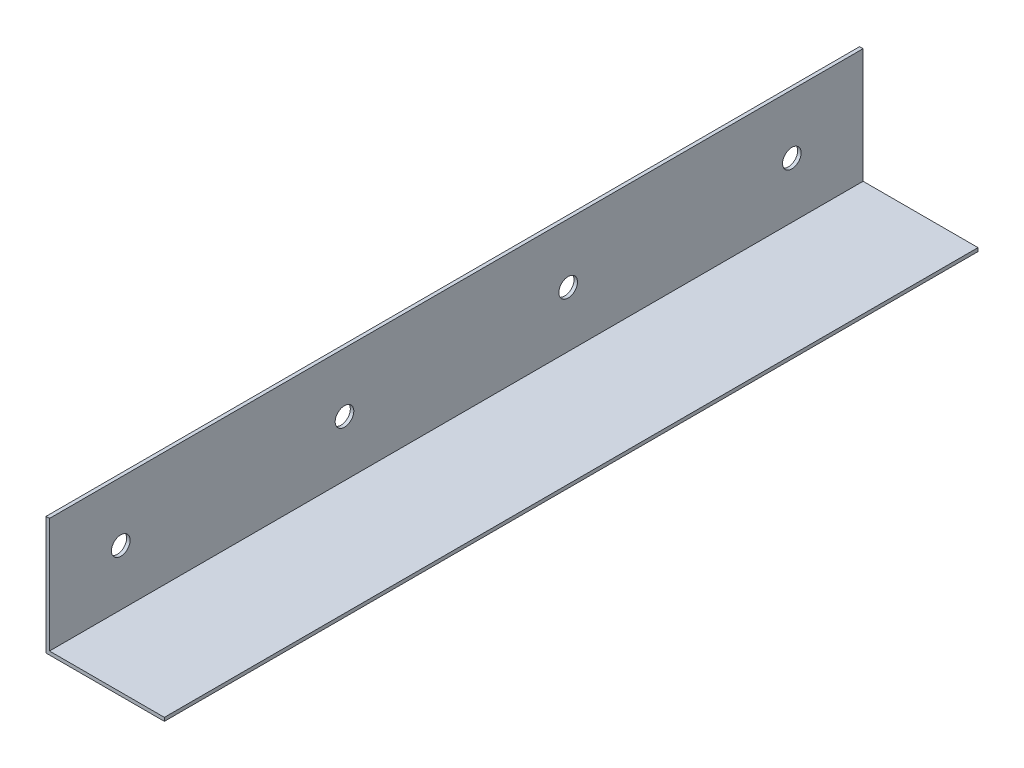
from build123d import *

# Parameters (mm, degrees)
SALIENTE_EXTRUIR1_DEPTH = 349.2
CROQUIS2_R              = 4
CORTAR_EXTRUIR1_DEPTH   = 2


with BuildPart() as part:
    # Croquis1 → Saliente-Extruir1 (new body)
    with BuildSketch(Plane.XY):
        Polygon((0, 0), (0, 50.8), (1.5, 50.8), (1.5, 1.5), (50.8, 1.5), (50.8, 0), align=None)
    extrude(amount=SALIENTE_EXTRUIR1_DEPTH)

    # Croquis2 → Cortar-Extruir1 (cut)
    with BuildSketch(Plane.ZY):
        with Locations((126.6, 25.4)):
            Circle(CROQUIS2_R)
        with Locations((222.6, 25.4)):
            Circle(CROQUIS2_R)
        with Locations((30.6, 25.4)):
            Circle(CROQUIS2_R)
        with Locations((318.6, 25.4)):
            Circle(CROQUIS2_R)
    extrude(amount=-CORTAR_EXTRUIR1_DEPTH, mode=Mode.SUBTRACT)


solid = part.part
